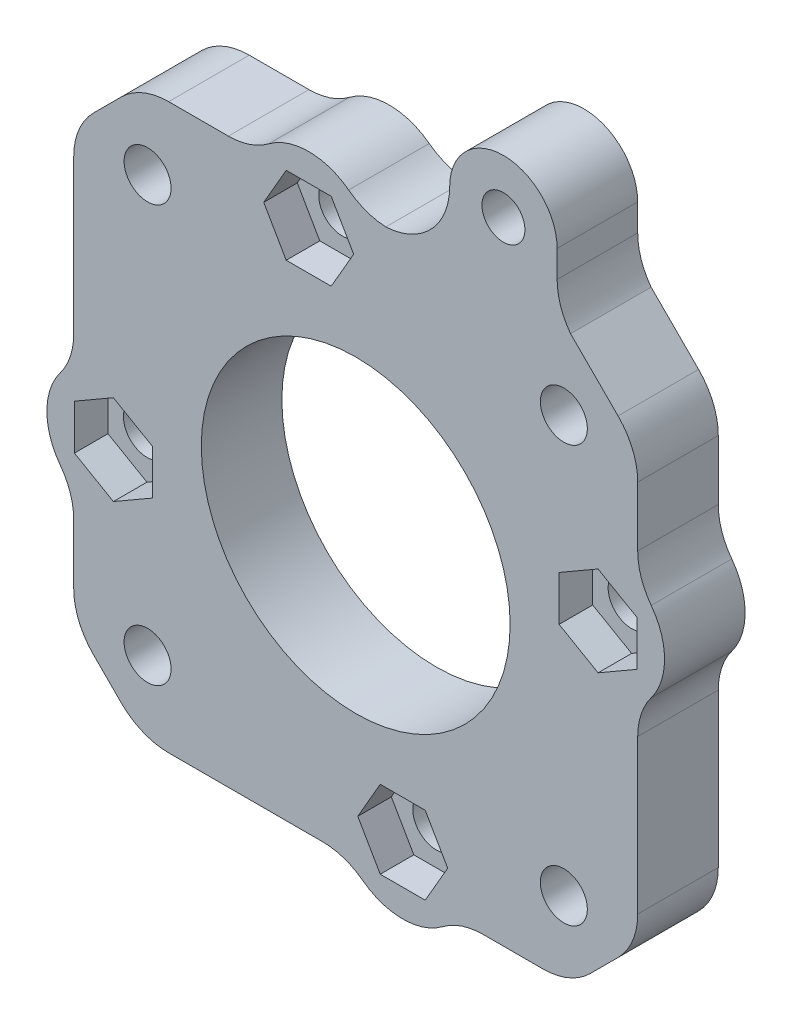
from build123d import *

# Parameters (mm, degrees)
SKETCH1_R           = 11.5
BOSS_EXTRUDE1_DEPTH = 6
SKETCH5_R           = 4.951700006
BOSS_EXTRUDE3_DEPTH = 6
SKETCH2_R           = 1.75
CUT_EXTRUDE1_DEPTH  = 34.075670817
SKETCH3_R           = 1.75
CUT_EXTRUDE2_DEPTH  = 34.075670817
CUT_EXTRUDE3_DEPTH  = 2.5
SKETCH6_R           = 1.6
BOSS_EXTRUDE4_DEPTH = 6
FILLET1_R           = 5


with BuildPart() as part:
    # Sketch1 → Boss-Extrude1 (new body)
    with BuildSketch(Plane.XY):
        Polygon((-21, 16), (-16, 21), (16, 21), (21, 16), (21, -16), (16, -21), (-16, -21), (-21, -16), align=None)
        Circle(SKETCH1_R, mode=Mode.SUBTRACT)
    extrude(amount=BOSS_EXTRUDE1_DEPTH)

    # Sketch5 → Boss-Extrude3 (add)
    with BuildSketch(Plane(origin=(0, 0, 0), x_dir=(-1, 0, 0), z_dir=(0, 0, -1))):
        with Locations((-18.048299994, 3.501266534)):
            Circle(SKETCH5_R)
        with Locations((3.501266534, 18.048299994)):
            Circle(SKETCH5_R)
        with Locations((18.048299994, -3.501266534)):
            Circle(SKETCH5_R)
        with Locations((-3.501266534, -18.048299994)):
            Circle(SKETCH5_R)
    extrude(amount=-BOSS_EXTRUDE3_DEPTH)

    # Sketch2 → Cut-Extrude1 (cut, through all)
    with BuildSketch(Plane.XY.offset(6)):
        with Locations((-15.5, 15.5)):
            Circle(SKETCH2_R)
        with Locations((15.5, 15.5)):
            Circle(SKETCH2_R)
        with Locations((15.5, -15.5)):
            Circle(SKETCH2_R)
        with Locations((-15.5, -15.5)):
            Circle(SKETCH2_R)
    extrude(amount=-CUT_EXTRUDE1_DEPTH, mode=Mode.SUBTRACT)

    # Sketch3 → Cut-Extrude2 (cut, through all)
    with BuildSketch(Plane.XY.offset(6)):
        with Locations((-3.501266534, 18.048299994)):
            Circle(SKETCH3_R)
        with Locations((18.048299994, 3.501266534)):
            Circle(SKETCH3_R)
        with Locations((3.501266534, -18.048299994)):
            Circle(SKETCH3_R)
        with Locations((-18.048299994, -3.501266534)):
            Circle(SKETCH3_R)
    extrude(amount=-CUT_EXTRUDE2_DEPTH, mode=Mode.SUBTRACT)

    # Sketch4 → Cut-Extrude3 (cut)
    with BuildSketch(Plane.XY.offset(6)):
        Polygon((-0.152634973, 18.048299994), (-1.826950753, 20.948299994), (-5.175582315, 20.948299994), (-6.849898095, 18.048299994), (-5.175582315, 15.148299994), (-1.826950753, 15.148299994), align=None)
        Polygon((18.048299994, 6.849898095), (15.148299994, 5.175582315), (15.148299994, 1.826950753), (18.048299994, 0.152634973), (20.948299994, 1.826950753), (20.948299994, 5.175582315), align=None)
        Polygon((-18.048299994, -6.849898095), (-15.148299994, -5.175582315), (-15.148299994, -1.826950753), (-18.048299994, -0.152634973), (-20.948299994, -1.826950753), (-20.948299994, -5.175582315), align=None)
        Polygon((6.849898095, -18.048299994), (5.175582315, -15.148299994), (1.826950753, -15.148299994), (0.152634973, -18.048299994), (1.826950753, -20.948299994), (5.175582315, -20.948299994), align=None)
    extrude(amount=-CUT_EXTRUDE3_DEPTH, mode=Mode.SUBTRACT)

    # Sketch6 → Boss-Extrude4 (add)
    with BuildSketch(Plane(origin=(0, 0, 0), x_dir=(-1, 0, 0), z_dir=(0, 0, -1))):
        with BuildLine():
            Line((-15, 26), (-15, 21))
            Line((-15, 21), (-7, 21))
            Line((-7, 21), (-7, 26))
            ThreePointArc((-7, 26), (-11, 30), (-15, 26))
        make_face()
        with Locations((-11, 26)):
            Circle(SKETCH6_R, mode=Mode.SUBTRACT)
    extrude(amount=-BOSS_EXTRUDE4_DEPTH)

    # Fillet1
    # the kernel refuses this fillet: 5 mm, written as the material it adds along each edge
    with BuildSketch(Plane(origin=(15, 21, 0), x_dir=(1, 0, 0), z_dir=(0, 0, 1))) as fillet1_piece_1:
        with BuildLine():
            CenterArc((5, 3), FILLET1_R, 180, 36.869897646)
            Line((0, 3), (0, 0))
            Line((0, 0), (1, 0))
        make_face()
    extrude(amount=6)
    with BuildSketch(Plane(origin=(7, 21, 0), x_dir=(-1, 0, 0), z_dir=(0, 0, 1))) as fillet1_piece_2:
        with BuildLine():
            CenterArc((FILLET1_R, -FILLET1_R), FILLET1_R, 90, 90)
            Line((0, -FILLET1_R), (0, 0))
            Line((0, 0), (FILLET1_R, 0))
        make_face()
    extrude(amount=6)
    with BuildSketch(Plane(origin=(7.477043191, -21, 6), x_dir=(-0.7048105163679362, -0.7093956131927819, 0), z_dir=(0, 0, -1)), Plane(origin=(-21, -7.477043191, 6), x_dir=(-0.7093956131927642, 0.7048105163679541, 0), z_dir=(0, 0, -1))) as fillet1_piece_3:
        with BuildLine():
            CenterArc((2.13164688, -4.948591109), FILLET1_R, 98.223270181, 36.962491831)
            Line((-1.415331186, -1.424538527), (0, 0))
            ThreePointArc((0, 0), (0.708246162, -0.050912281), (1.416492325, 0))
        make_face()
    extrude(amount=6)
    with BuildSketch(Plane(origin=(-0.474510123, -21, 6), x_dir=(-1, 0, 0), z_dir=(0, 0, -1)), Plane(origin=(-21, 0.474510123, 6), x_dir=(0, 1, 0), z_dir=(0, 0, -1))) as fillet1_piece_4:
        with BuildLine():
            CenterArc((2.008101686, -5), FILLET1_R, 90, 36.962491831)
            ThreePointArc((-0.998358687, -1.004853441), (-0.463062395, -0.538310232), (0, 0))
            Line((0, 0), (2.008101686, 0))
        make_face()
    extrude(amount=6)
    with BuildSketch(Plane(origin=(-7.477043191, 21, 6), x_dir=(-1, 0, 0), z_dir=(0, 0, -1)), Plane(origin=(21, 7.477043191, 6), x_dir=(0, 1, 0), z_dir=(0, 0, -1))) as fillet1_piece_5:
        with BuildLine():
            CenterArc((2.008101686, 5), FILLET1_R, 233.037508169, 36.962491831)
            ThreePointArc((-0.998358687, 1.004853441), (-0.463062395, 0.538310232), (0, 0))
            Line((0, 0), (2.008101686, 0))
        make_face()
    extrude(amount=6)
    with BuildSketch(Plane(origin=(0.474510123, 21, 6), x_dir=(-0.7048105163680716, 0.7093956131926475, 0), z_dir=(0, 0, -1)), Plane(origin=(21, -0.474510123, 6), x_dir=(0.7093956131926695, 0.7048105163680495, 0), z_dir=(0, 0, -1))) as fillet1_piece_6:
        with BuildLine():
            CenterArc((2.13164688, 4.948591109), FILLET1_R, 224.814237988, 36.962491831)
            Line((-1.415331186, 1.424538527), (0, 0))
            ThreePointArc((0, 0), (0.708246162, 0.050912281), (1.416492325, 0))
        make_face()
    extrude(amount=6)
    # the kernel refuses this fillet: 5 mm, written as the material it takes off along each edge
    with BuildSketch(Plane(origin=(21, -16, -5.17766953), x_dir=(0, 1, 0), z_dir=(0, 0, 1)), Plane(origin=(16, -21, -5.17766953), x_dir=(0.7071067811865476, 0.7071067811865476, 0), z_dir=(0, 0, 1)), Plane(origin=(-16, -21, -5.17766953), x_dir=(1, 0, 0), z_dir=(0, 0, 1)), Plane(origin=(-21, -16, -5.17766953), x_dir=(0.7071067811865476, -0.7071067811865476, 0), z_dir=(0, 0, 1)), Plane(origin=(-16, 21, -5.17766953), x_dir=(-0.7071067811865476, -0.7071067811865476, 0), z_dir=(0, 0, 1)), Plane(origin=(21, 16, -5.17766953), x_dir=(-0.7071067811865476, 0.7071067811865476, 0), z_dir=(0, 0, 1))) as fillet1_2_piece_1:
        with BuildLine():
            CenterArc((FILLET1_R * 0.414213562373, FILLET1_R), FILLET1_R, 225, 45)
            Line((-FILLET1_R * 0.292893218813, FILLET1_R * 0.292893218813), (0, 0))
            Line((0, 0), (FILLET1_R * 0.414213562373, 0))
        make_face()
    extrude(amount=16.355339059, mode=Mode.SUBTRACT)
    with BuildSketch(Plane(origin=(-21, 16, -5.17766953), x_dir=(0.7071067811865476, 0.7071067811865476, 0), z_dir=(0, 0, 1))) as fillet1_2_piece_2:
        with BuildLine():
            CenterArc((FILLET1_R * 0.414213562373, -FILLET1_R), FILLET1_R, 90, 45)
            Line((-FILLET1_R * 0.292893218813, -FILLET1_R * 0.292893218813), (0, 0))
            Line((0, 0), (FILLET1_R * 0.414213562373, 0))
        make_face()
    extrude(amount=16.355339059, mode=Mode.SUBTRACT)


solid = part.part
